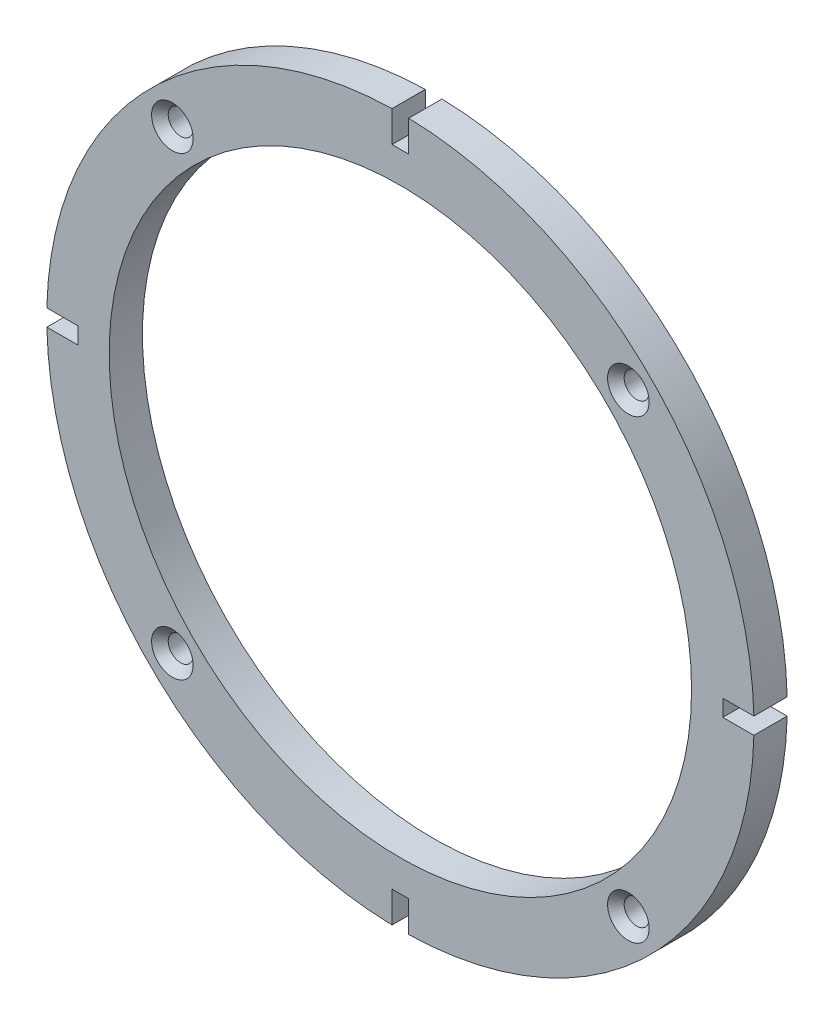
from build123d import *

# Parameters (mm, degrees)
SKETCH1_R                  = 70
BOSS_EXTRUDE1_DEPTH        = 8
SKETCH2_R                  = 3
WYTNIJ_WYCI_GNI_CIE1_DEPTH = 10
SZKIC1_R                   = 5
WYTNIJ_WYCI_GNI_CIE2_DEPTH = 2
SZYK_KO_OWY1_COUNT         = 4
SFAZOWANIE1_SIZE           = 2


with BuildPart() as part:
    # Sketch1 → Boss-Extrude1 (new body)
    with BuildSketch(Plane.XY):
        with BuildLine():
            ThreePointArc((2, -84.976467331), (60.104076401, -60.104076401), (84.976467331, -2))
            Line((84.976467331, -2), (77.499555144, -2))
            Line((77.499555144, -2), (77.499555144, 2))
            Line((77.499555144, 2), (84.976467331, 2))
            ThreePointArc((84.976467331, 2), (60.104076401, 60.104076401), (2, 84.976467331))
            Line((2, 84.976467331), (2, 77.499555144))
            Line((2, 77.499555144), (-2, 77.499555144))
            Line((-2, 77.499555144), (-2, 84.976467331))
            ThreePointArc((-2, 84.976467331), (-60.104076401, 60.104076401), (-84.976467331, 2))
            Line((-84.976467331, 2), (-77.499555144, 2))
            Line((-77.499555144, 2), (-77.499555144, -2))
            Line((-77.499555144, -2), (-84.976467331, -2))
            ThreePointArc((-84.976467331, -2), (-60.104076401, -60.104076401), (-2, -84.976467331))
            Line((-2, -84.976467331), (-2, -77.499555144))
            Line((-2, -77.499555144), (2, -77.499555144))
            Line((2, -77.499555144), (2, -84.976467331))
        make_face()
        Circle(SKETCH1_R, mode=Mode.SUBTRACT)
    extrude(amount=BOSS_EXTRUDE1_DEPTH)

    # Sketch2 → Wytnij-wyciągnięcie1 (cut)
    with BuildSketch(Plane(origin=(0, 0, 0), x_dir=(-1, 0, 0), z_dir=(0, 0, -1))):
        with Locations((-54.800775542, 54.800775542)):
            Circle(SKETCH2_R)
        with Locations((54.800775542, 54.800775542)):
            Circle(SKETCH2_R)
        with Locations((54.800775542, -54.800775542)):
            Circle(SKETCH2_R)
        with Locations((-54.800775542, -54.800775542)):
            Circle(SKETCH2_R)
    extrude(amount=-WYTNIJ_WYCI_GNI_CIE1_DEPTH, mode=Mode.SUBTRACT)

    # Szkic1 → Wytnij-wyciągnięcie2 (cut)
    with BuildSketch(Plane(origin=(0, 0, 0), x_dir=(-1, 0, 0), z_dir=(0, 0, -1))):
        with Locations((-54.800775542, 54.800775542)):
            Circle(SZKIC1_R)
    wytnij_wyci_gni_cie2 = extrude(amount=-WYTNIJ_WYCI_GNI_CIE2_DEPTH, mode=Mode.SUBTRACT)

    # Szyk kołowy1: Wytnij-wyciągnięcie2 ×4 about axis
    szyk_ko_owy1_axis = Axis((0, 0, 8), (0, 0, -1))
    for i in range(1, SZYK_KO_OWY1_COUNT):
        add(wytnij_wyci_gni_cie2.rotate(szyk_ko_owy1_axis, i * 360 / SZYK_KO_OWY1_COUNT), mode=Mode.SUBTRACT)

    # Sfazowanie1
    sfazowanie1_edges = [part.edges().sort_by_distance(p)[0] for p in [
        (57.800775542, -54.800775542, 8),
        (57.800775542, 54.800775542, 8),
        (-51.800775542, 54.800775542, 8),
        (-51.800775542, -54.800775542, 8),
    ]]
    chamfer(sfazowanie1_edges, length=SFAZOWANIE1_SIZE)


solid = part.part
